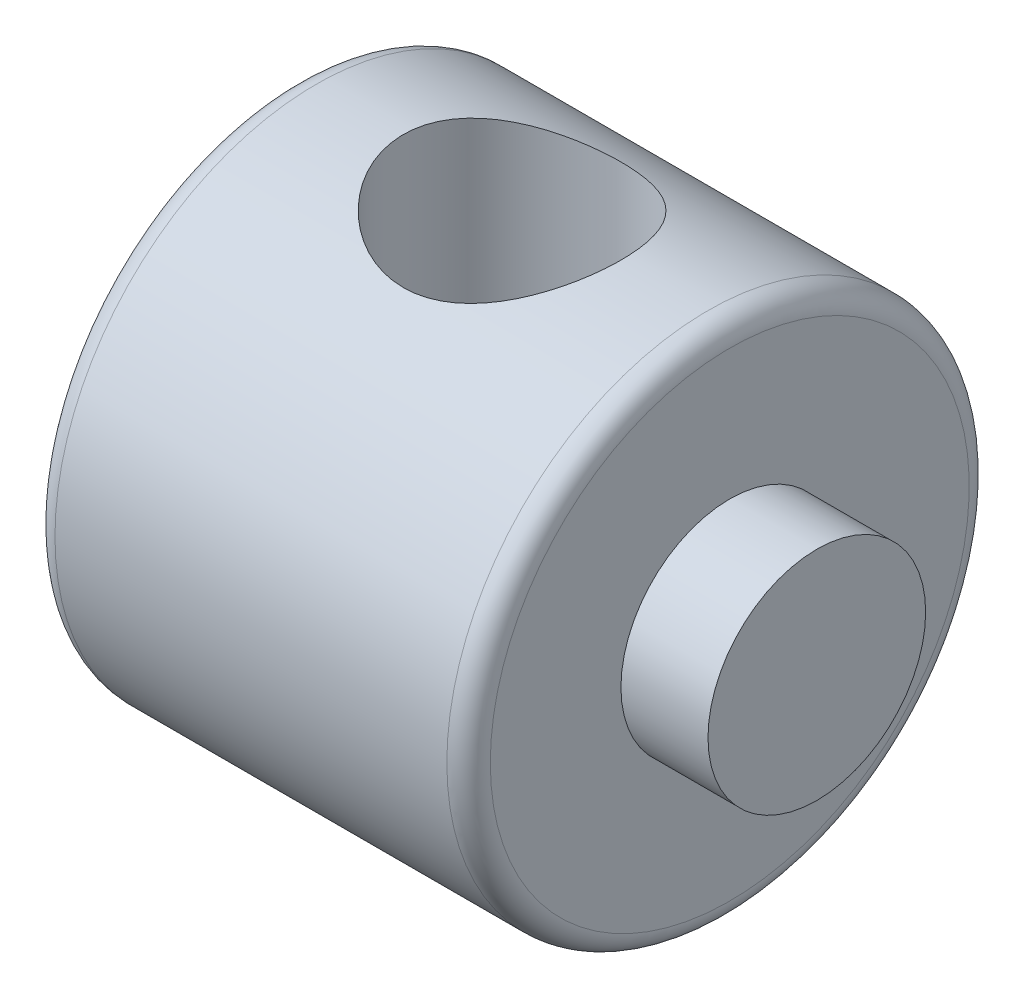
from build123d import *

# Parameters (mm, degrees)
FILLET1_R               = 0.79248
F_3_8_16_TAPPED_HOLE1_D = 7.9375


with BuildPart() as part:
    # Sketch1 → Revolve1 (revolve)
    with BuildSketch(Plane.XY):
        Polygon((-11.1125, 0), (-11.1125, 3.96875), (-7.9375, 3.96875), (-7.9375, 9.525), (7.9375, 9.525), (7.9375, 3.96875), (11.1125, 3.96875), (11.1125, 0), align=None)
    revolve(axis=Axis((-58.389715759, 0, 0), (1, 0, 0)))

    # Fillet1
    fillet1_edges = [part.edges().sort_by_distance(p)[0] for p in [
        (-7.9375, -9.525, 0),
        (7.9375, -9.525, 0),
    ]]
    fillet(fillet1_edges, radius=FILLET1_R)

    # 3/8-16 Tapped Hole1 (through all)
    with Locations(Plane.ZX.offset(9.525)):
        with Locations((0, 0)):
            Hole(F_3_8_16_TAPPED_HOLE1_D / 2)


solid = part.part
